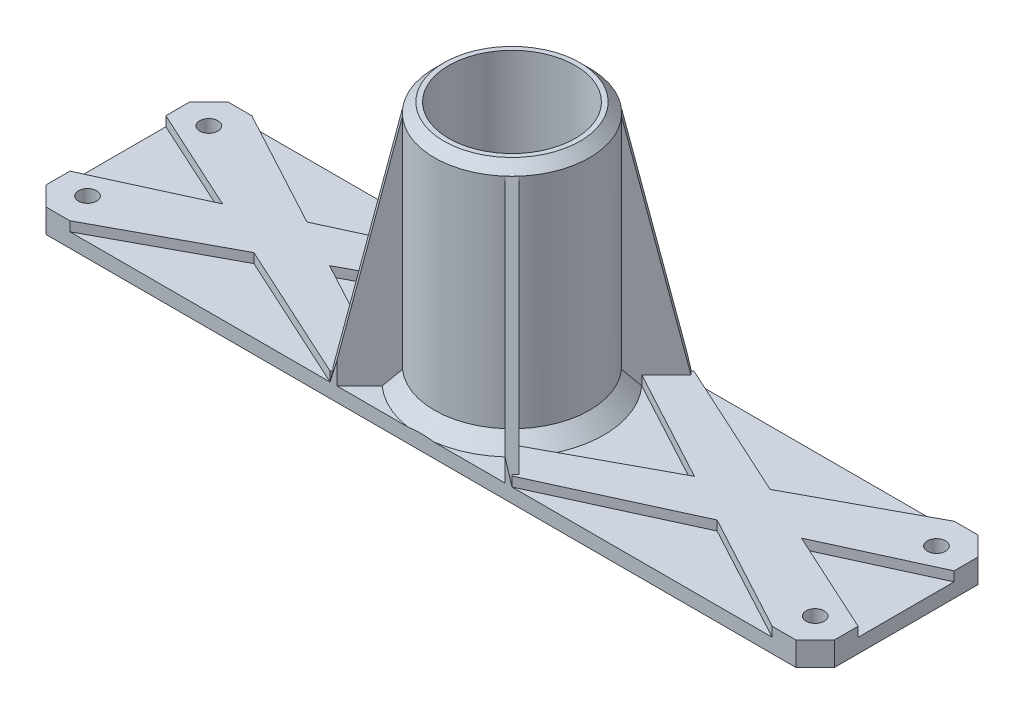
from build123d import *

# Parameters (mm, degrees)
SKETCH1_W                = 165.1
SKETCH1_H                = 38.1
BOSS_EXTRUDE1_DEPTH      = 3
SKETCH2_R                = 1.9
CUT_EXTRUDE1_DEPTH       = 3
CHAMFER1_SIZE            = 4
SKETCH3_R                = 16.25
SKETCH3_R_2              = 13.25
BOSS_EXTRUDE2_DEPTH      = 50.8
SKETCH4_R                = 9
CUT_EXTRUDE2_DEPTH       = 50.8
CHAMFER2_SIZE            = 2
BOSS_EXTRUDE5_DEPTH      = 1
BOSS_EXTRUDE5_DEPTH_BACK = 1
BOSS_EXTRUDE6_DEPTH      = 1
BOSS_EXTRUDE6_DEPTH_BACK = 1
SKETCH10_W               = 48.027930054
SKETCH10_H               = 3.446227712
SKETCH10_W_2             = 45.229873501
SKETCH10_H_2             = 2.308850273
CUT_EXTRUDE3_DEPTH       = 51
CHAMFER3_SIZE            = 3
BOSS_EXTRUDE7_START      = 2
SKETCH12_R               = 1.9
BOSS_EXTRUDE7_DEPTH      = 2


with BuildPart() as part:
    # Sketch1 → Boss-Extrude1 (new body)
    with BuildSketch(Plane(origin=(0, 0, 0), x_dir=(1, 0, 0), z_dir=(0, 1, 0))):
        Rectangle(SKETCH1_W, SKETCH1_H)
    extrude(amount=BOSS_EXTRUDE1_DEPTH)

    # Sketch2 → Cut-Extrude1 (cut)
    with BuildSketch(Plane(origin=(0, 3, 0), x_dir=(1, 0, 0), z_dir=(0, 1, 0))):
        with Locations(Location((-76.2, 12.7, 0), (0, 0, 270))):
            Circle(SKETCH2_R)
        with Locations(Location((-76.2, -12.7, 0), (0, 0, 270))):
            Circle(SKETCH2_R)
        with Locations(Location((76.2, 12.7, 0), (0, 0, 270))):
            Circle(SKETCH2_R)
        with Locations(Location((76.2, -12.7, 0), (0, 0, 270))):
            Circle(SKETCH2_R)
    extrude(amount=-CUT_EXTRUDE1_DEPTH, mode=Mode.SUBTRACT)

    # Chamfer1
    chamfer1_edges = [part.edges().sort_by_distance(p)[0] for p in [
        (82.55, 1.5, 19.05),
        (-82.55, 1.5, 19.05),
        (-82.55, 1.5, -19.05),
        (82.55, 1.5, -19.05),
    ]]
    chamfer(chamfer1_edges, length=CHAMFER1_SIZE)

    # Sketch3 → Boss-Extrude2 (add)
    with BuildSketch(Plane(origin=(0, 3, 0), x_dir=(1, 0, 0), z_dir=(0, 1, 0))):
        with Locations(Location((0, 0, 0), (0, 0, 270))):
            Circle(SKETCH3_R)
        with Locations(Location((0, 0, 0), (0, 0, 270))):
            Circle(SKETCH3_R_2, mode=Mode.SUBTRACT)
    extrude(amount=BOSS_EXTRUDE2_DEPTH)

    # Sketch4 → Cut-Extrude2 (cut)
    with BuildSketch(Plane(origin=(0, 3, 0), x_dir=(1, 0, 0), z_dir=(0, 1, 0))):
        with Locations(Location((0, 0, 0), (0, 0, 270))):
            Circle(SKETCH4_R)
    extrude(amount=-CUT_EXTRUDE2_DEPTH, mode=Mode.SUBTRACT)

    # Chamfer2
    chamfer2_edges = [part.edges().sort_by_distance(p)[0] for p in [
        (0, 53.8, -16.25),
    ]]
    chamfer(chamfer2_edges, length=CHAMFER2_SIZE)

    # Sketch8 → Boss-Extrude5 (add, two sides: drawn at the far end of the back side and taken through both)
    with BuildSketch(Plane(origin=(0, 0, 0), x_dir=(0.7071067811865465, 0, -0.7071067811865486), z_dir=(0.7071067811865486, 0, 0.7071067811865465)).offset(-BOSS_EXTRUDE5_DEPTH_BACK)):
        Polygon((-16.25, 51.8), (-26.940768363, 3), (-15.761884805, 3), align=None)
        Polygon((16.25, 51.8), (26.940768363, 3), (15.672352265, 3), align=None)
    extrude(amount=BOSS_EXTRUDE5_DEPTH + BOSS_EXTRUDE5_DEPTH_BACK)

    # Sketch9 → Boss-Extrude6 (add, two sides: drawn at the far end of the back side and taken through both)
    with BuildSketch(Plane(origin=(0, 0, 0), x_dir=(-0.7071067811865513, 0, -0.7071067811865437), z_dir=(0.7071067811865437, 0, -0.7071067811865513)).offset(-BOSS_EXTRUDE6_DEPTH_BACK)):
        Polygon((16.03800498, 52.01199502), (26.940768363, 3), (15.332503188, 3), align=None)
        Polygon((-15.086213557, 3), (-16.25, 51.8), (-26.940768363, 3), align=None)
    extrude(amount=BOSS_EXTRUDE6_DEPTH + BOSS_EXTRUDE6_DEPTH_BACK)

    # Sketch10 → Cut-Extrude3 (cut)
    with BuildSketch(Plane.XZ):
        with Locations((0.613627604, 20.773113856)):
            Rectangle(SKETCH10_W, SKETCH10_H)
        with Locations((-0.375624438, -20.204425136)):
            Rectangle(SKETCH10_W_2, SKETCH10_H_2)
    extrude(amount=-CUT_EXTRUDE3_DEPTH, mode=Mode.SUBTRACT)

    # Chamfer3
    # the kernel refuses this chamfer: 3 mm, written as the material it adds along each edge
    with BuildSketch(Plane(origin=(0, 3, 0), x_dir=(-0.363517845184437, 0, -0.9315872349020589), z_dir=(0.9315872349020589, 0, -0.363517845184437))) as chamfer3_piece_1:
        Polygon((16.25 + CHAMFER3_SIZE, 0), (16.25, CHAMFER3_SIZE), (16.25, 0), align=None)
    revolve(axis=Axis((0, 3, 0), (0, 1, 0)), revolution_arc=137.36720641)
    with BuildSketch(Plane(origin=(0, 3, 0), x_dir=(0.3635178451844628, 0, 0.9315872349020488), z_dir=(-0.9315872349020488, 0, 0.3635178451844628))) as chamfer3_piece_2:
        Polygon((16.25 + CHAMFER3_SIZE, 0), (16.25, CHAMFER3_SIZE), (16.25, 0), align=None)
    revolve(axis=Axis((0, 3, 0), (0, 1, 0)), revolution_arc=137.36720641)
    with BuildSketch(Plane(origin=(0, 3, 0), x_dir=(-0.9315872349020518, 0, 0.363517845184455), z_dir=(-0.363517845184455, 0, -0.9315872349020518))) as chamfer3_piece_3_section:
        Polygon((16.25, CHAMFER3_SIZE), (16.25 + CHAMFER3_SIZE, 0), (16.25, 0), align=None)
    chamfer3_piece_3 = revolve(axis=Axis((0, 3, 0), (0, 1, 0)), revolution_arc=137.36720641, mode=Mode.PRIVATE)
    chamfer3_piece_3 = split(chamfer3_piece_3, bisect_by=Plane(origin=(-14.04599825, 3.973842114, 19.05), z_dir=(0, 0, -1)), keep=Keep.TOP, mode=Mode.PRIVATE)
    add(chamfer3_piece_3)
    with BuildSketch(Plane(origin=(0, 3, 0), x_dir=(0.9315872349020476, 0, -0.3635178451844656), z_dir=(0.3635178451844656, 0, 0.9315872349020476))) as chamfer3_piece_4_section:
        Polygon((16.25 + CHAMFER3_SIZE, 0), (16.25, CHAMFER3_SIZE), (16.25, 0), align=None)
    chamfer3_piece_4 = revolve(axis=Axis((0, 3, 0), (0, 1, 0)), revolution_arc=137.36720641, mode=Mode.PRIVATE)
    chamfer3_piece_4 = split(chamfer3_piece_4, bisect_by=Plane(origin=(14.045998398, 3.973842011, -19.05), z_dir=(0, 0, 1)), keep=Keep.TOP, mode=Mode.PRIVATE)
    add(chamfer3_piece_4)

    # Sketch12 → Boss-Extrude7 (add)
    # profile 1 of 2: a face of its own
    with BuildSketch(Plane(origin=(0, 3, 0), x_dir=(1, 0, 0), z_dir=(0, 1, 0)).offset(BOSS_EXTRUDE7_START)):
        Polygon((-19.05, 19.05), (-48.506345534, 5.551107795), (-73.55, 19.05), (-78.55, 19.05), (-82.55, 15.05), (-82.55, 10.05), (-60.619587629, 0), (-82.55, -10.05), (-82.55, -15.05), (-78.55, -19.05), (-73.55, -19.05), (-48.506345534, -5.551107795), (-19.05, -19.05), (-14.300533501, -12.886319939), (-38.207720772, 0), (-14.300533501, 12.886319939), align=None)
        with Locations(Location((-76.2, 12.7, 0), (0, 0, 270))):
            Circle(SKETCH12_R, mode=Mode.SUBTRACT)
        with Locations(Location((-76.2, -12.7, 0), (0, 0, 270))):
            Circle(SKETCH12_R, mode=Mode.SUBTRACT)
    # profile 2 of 2: a face of its own
    with BuildSketch(Plane(origin=(0, 3, 0), x_dir=(1, 0, 0), z_dir=(0, 1, 0)).offset(BOSS_EXTRUDE7_START)):
        Polygon((14.300533501, 12.886319939), (38.207720772, 0), (14.300533501, -12.886319939), (19.05, -19.05), (48.506345534, -5.551107795), (73.55, -19.05), (78.55, -19.05), (82.55, -15.05), (82.55, -10.05), (60.619587629, 0), (82.55, 10.05), (82.55, 15.05), (78.55, 19.05), (73.55, 19.05), (48.506345534, 5.551107795), (19.05, 19.05), align=None)
        with Locations(Location((76.2, 12.7, 0), (0, 0, 270))):
            Circle(SKETCH12_R, mode=Mode.SUBTRACT)
        with Locations(Location((76.2, -12.7, 0), (0, 0, 270))):
            Circle(SKETCH12_R, mode=Mode.SUBTRACT)
    extrude(amount=-BOSS_EXTRUDE7_DEPTH)


solid = part.part
